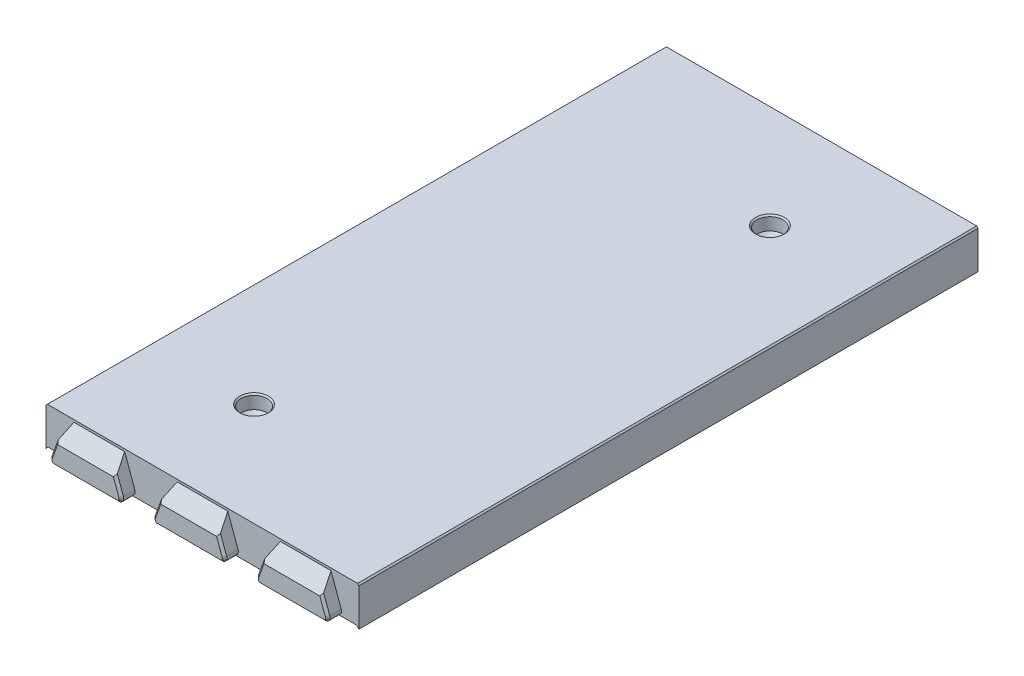
from build123d import *

# Parameters (mm, degrees)
BOSS_EXTRUDE1_DEPTH             = 67.5
SKETCH7_W                       = 64.25
SKETCH7_H                       = 6
BOSS_EXTRUDE7_DEPTH             = 1
BOSS_EXTRUDE4_DEPTH             = 3
BOSS_EXTRUDE8_REACH             = 78.058
BOSS_EXTRUDE8_DIRECTION_2_DEPTH = 2
CHAMFER4_SIZE                   = 0.5
FILLET4_R                       = 1
CHAMFER6_SIZE                   = 0.5
FILLET2_R                       = 2
CHAMFER4_OF_MIRROR2_SIZE        = 0.5
FILLET4_OF_MIRROR2_R            = 1
CHAMFER6_OF_MIRROR2_SIZE        = 0.5
FILLET2_OF_MIRROR2_R            = 2
BOSS_EXTRUDE9_REACH             = 144.382
SKETCH9_R                       = 5
FILLET3_R                       = 3
SKETCH10_R                      = 1.85
CUT_EXTRUDE2_DEPTH              = 143.381584571
SKETCH11_R                      = 2.85
CUT_EXTRUDE3_DEPTH              = 3
CHAMFER7_SIZE                   = 1
CUT_EXTRUDE4_DEPTH              = 143.381584571
CUT_EXTRUDE4_DEPTH_BACK         = 143.381584571
BOSS_EXTRUDE10_DEPTH            = 135
CHAMFER8_SIZE                   = 0.3


with BuildPart() as part:
    # Sketch1 → Boss-Extrude1 (new body)
    with BuildSketch(Plane.XY):
        Polygon((-34.125, 0), (-34.125, 8), (34.125, 8), (34.125, 0), (32.125, 0), (32.125, 6), (-32.125, 6), (-32.125, 0), align=None)
    boss_extrude1 = extrude(amount=-BOSS_EXTRUDE1_DEPTH)

    # Sketch7 → Boss-Extrude7 (add)
    with BuildSketch(Plane.XY):
        with Locations((0, 3)):
            Rectangle(SKETCH7_W, SKETCH7_H)
    boss_extrude7 = extrude(amount=-BOSS_EXTRUDE7_DEPTH)

    # Sketch2 → Boss-Extrude4 (add)
    with BuildSketch(Plane.XY):
        Polygon((17.161761874, 8), (14.25, 0), (30.75, 0), (27.838238126, 8), align=None)
        Polygon((-5.338238126, 8), (-8.25, 0), (8.25, 0), (5.338238126, 8), align=None)
        Polygon((-27.838238126, 8), (-30.75, 0), (-14.25, 0), (-17.161761874, 8), align=None)
    boss_extrude4 = extrude(amount=BOSS_EXTRUDE4_DEPTH)

    # Sketch8 → Boss-Extrude8 (add, up to next)
    with BuildSketch(Plane.XZ, mode=Mode.PRIVATE) as boss_extrude8_sk1:
        Polygon((-32.75, -24.955880937), (-32.75, -20.044119063), (-28.75, -21.5), (-28.75, -23.5), align=None)
    boss_extrude8_tool1 = extrude(boss_extrude8_sk1.sketch, amount=-BOSS_EXTRUDE8_REACH, mode=Mode.PRIVATE) - part.part
    # Sketch8 → Boss-Extrude8 (add, up to next)
    with BuildSketch(Plane.XZ, mode=Mode.PRIVATE) as boss_extrude8_sk2:
        Polygon((-32.75, -67.5), (-32.75, -65.044119063), (-28.75, -66.5), (-28.75, -67.5), align=None)
    boss_extrude8_tool2 = extrude(boss_extrude8_sk2.sketch, amount=-BOSS_EXTRUDE8_REACH, mode=Mode.PRIVATE) - part.part
    # Sketch8 → Boss-Extrude8 (add, up to next)
    with BuildSketch(Plane.XZ, mode=Mode.PRIVATE) as boss_extrude8_sk3:
        Polygon((32.75, -24.955880937), (28.75, -23.5), (28.75, -21.5), (32.75, -20.044119063), align=None)
    boss_extrude8_tool3 = extrude(boss_extrude8_sk3.sketch, amount=-BOSS_EXTRUDE8_REACH, mode=Mode.PRIVATE) - part.part
    # Sketch8 → Boss-Extrude8 (add, up to next)
    with BuildSketch(Plane.XZ, mode=Mode.PRIVATE) as boss_extrude8_sk4:
        Polygon((28.75, -67.5), (32.75, -67.5), (32.75, -65.044119063), (28.75, -66.5), align=None)
    boss_extrude8_tool4 = extrude(boss_extrude8_sk4.sketch, amount=-BOSS_EXTRUDE8_REACH, mode=Mode.PRIVATE) - part.part
    boss_extrude8_1 = boss_extrude8_tool1.solids().sort_by_distance((-31.030851, 0, -22.5))[0]
    add(boss_extrude8_1)
    boss_extrude8_2 = boss_extrude8_tool2.solids().sort_by_distance((-31.030851, 0, -66.584919))[0]
    add(boss_extrude8_2)
    boss_extrude8_3 = boss_extrude8_tool3.solids().sort_by_distance((31.030851, 0, -22.5))[0]
    add(boss_extrude8_3)
    boss_extrude8_4 = boss_extrude8_tool4.solids().sort_by_distance((31.030851, 0, -66.584919))[0]
    add(boss_extrude8_4)
    boss_extrude8 = boss_extrude8_1 + boss_extrude8_2 + boss_extrude8_3 + boss_extrude8_4  # Boss-Extrude8 as one shape, for the pattern or mirror that repeats it

    # Sketch8 → Boss-Extrude8 direction 2 (add)
    with BuildSketch(Plane.XZ):
        Polygon((-32.75, -24.955880937), (-32.75, -20.044119063), (-28.75, -21.5), (-28.75, -23.5), align=None)
        Polygon((-32.75, -67.5), (-32.75, -65.044119063), (-28.75, -66.5), (-28.75, -67.5), align=None)
        Polygon((32.75, -24.955880937), (28.75, -23.5), (28.75, -21.5), (32.75, -20.044119063), align=None)
        Polygon((28.75, -67.5), (32.75, -67.5), (32.75, -65.044119063), (28.75, -66.5), align=None)
    boss_extrude8_direction_2 = extrude(amount=BOSS_EXTRUDE8_DIRECTION_2_DEPTH)

    # Chamfer4
    chamfer4_edges = [part.edges().sort_by_distance(p)[0] for p in [
        (-30.75, -2, -20.772059531),
        (-32.75, -2, -22.5),
        (-30.75, -2, -24.227940469),
        (-28.75, -2, -22.5),
        (32.75, -2, -22.5),
        (30.75, -2, -20.772059531),
        (28.75, -2, -22.5),
        (30.75, -2, -24.227940469),
        (28.75, -2, -67),
        (32.75, -2, -66.272059531),
        (30.75, -2, -65.772059531),
        (-28.75, -2, -67),
        (-30.75, -2, -65.772059531),
        (-32.75, -2, -66.272059531),
    ]]
    chamfer(chamfer4_edges, length=CHAMFER4_SIZE)

    # Fillet4
    fillet4_edges = [part.edges().sort_by_distance(p)[0] for p in [
        (14.25, 0, 1.5),
        (30.75, 0, 1.5),
        (-8.25, 0, 1.5),
        (8.25, 0, 1.5),
        (-30.75, 0, 1.5),
        (-14.25, 0, 1.5),
    ]]
    fillet(fillet4_edges, radius=FILLET4_R)

    # Chamfer6
    chamfer6_edges = [part.edges().sort_by_distance(p)[0] for p in [
        (22.5, 0, 3),
        (0, 0, 3),
        (-22.5, 0, 3),
        (-15.95010863, 4.671010072, 3),
        (-14.858995962, 0.426423564, 3),
        (-30.141004038, 0.426423564, 3),
        (6.54989137, 4.671010072, 3),
        (7.641004038, 0.426423564, 3),
        (-7.641004038, 0.426423564, 3),
        (29.04989137, 4.671010072, 3),
        (30.141004038, 0.426423564, 3),
        (14.858995962, 0.426423564, 3),
        (15.95010863, 4.671010072, 3),
        (-6.54989137, 4.671010072, 3),
        (-29.04989137, 4.671010072, 3),
    ]]
    chamfer(chamfer6_edges, length=CHAMFER6_SIZE)

    # Fillet2
    fillet2_edges = [part.edges().sort_by_distance(p)[0] for p in [
        (-32.125, 6, -10.63580023),
        (-32.125, 3, -20.271600459),
        (-32.125, 3, -24.728399541),
        (-30.4375, 6, -20.88580023),
        (-28.75, 6, -22.5),
        (-30.4375, 6, -24.11419977),
        (32.125, 6, -10.63580023),
        (32.125, 3, -20.271600459),
        (32.125, 3, -24.728399541),
        (30.4375, 6, -20.88580023),
        (30.4375, 6, -24.11419977),
        (28.75, 6, -22.5),
        (32.125, 6, -45),
        (32.125, 3, -65.271600459),
        (28.75, 6, -67),
        (30.4375, 6, -65.88580023),
        (-32.125, 3, -1),
        (0, 6, -1),
        (32.125, 3, -1),
        (-32.125, 6, -45),
        (-32.125, 3, -65.271600459),
        (-28.75, 6, -67),
        (-30.4375, 6, -65.88580023),
    ]]
    fillet(fillet2_edges, radius=FILLET2_R)


with BuildPart() as mirror2_1:
    # Mirror2: Boss-Extrude1, Boss-Extrude7, Boss-Extrude4, Boss-Extrude8, Boss-Extrude8 direction 2 across plane
    add(boss_extrude1.mirror(Plane.XY.offset(-67.5)))
    add(boss_extrude7.mirror(Plane.XY.offset(-67.5)))
    add(boss_extrude4.mirror(Plane.XY.offset(-67.5)))
    add(boss_extrude8.mirror(Plane.XY.offset(-67.5)))
    add(boss_extrude8_direction_2.mirror(Plane.XY.offset(-67.5)))

    # Chamfer4 of Mirror2
    chamfer4_of_mirror2_edges = [mirror2_1.edges().sort_by_distance(p)[0] for p in [
        (-30.75, -2, -114.227940469),
        (-32.75, -2, -112.5),
        (-30.75, -2, -110.772059531),
        (-28.75, -2, -112.5),
        (32.75, -2, -112.5),
        (30.75, -2, -114.227940469),
        (28.75, -2, -112.5),
        (30.75, -2, -110.772059531),
        (28.75, -2, -68),
        (32.75, -2, -68.727940469),
        (30.75, -2, -69.227940469),
        (-28.75, -2, -68),
        (-30.75, -2, -69.227940469),
        (-32.75, -2, -68.727940469),
    ]]
    chamfer(chamfer4_of_mirror2_edges, length=CHAMFER4_OF_MIRROR2_SIZE)

    # Fillet4 of Mirror2
    fillet4_of_mirror2_edges = [mirror2_1.edges().sort_by_distance(p)[0] for p in [
        (14.25, 0, -136.5),
        (30.75, 0, -136.5),
        (-8.25, 0, -136.5),
        (8.25, 0, -136.5),
        (-30.75, 0, -136.5),
        (-14.25, 0, -136.5),
    ]]
    fillet(fillet4_of_mirror2_edges, radius=FILLET4_OF_MIRROR2_R)

    # Chamfer6 of Mirror2
    chamfer6_of_mirror2_edges = [mirror2_1.edges().sort_by_distance(p)[0] for p in [
        (22.5, 0, -138),
        (0, 0, -138),
        (-22.5, 0, -138),
        (-15.95010863, 4.671010072, -138),
        (-14.858995962, 0.426423564, -138),
        (-30.141004038, 0.426423564, -138),
        (6.54989137, 4.671010072, -138),
        (7.641004038, 0.426423564, -138),
        (-7.641004038, 0.426423564, -138),
        (29.04989137, 4.671010072, -138),
        (30.141004038, 0.426423564, -138),
        (14.858995962, 0.426423564, -138),
        (15.95010863, 4.671010072, -138),
        (-6.54989137, 4.671010072, -138),
        (-29.04989137, 4.671010072, -138),
    ]]
    chamfer(chamfer6_of_mirror2_edges, length=CHAMFER6_OF_MIRROR2_SIZE)

    # Fillet2 of Mirror2
    fillet2_of_mirror2_edges = [mirror2_1.edges().sort_by_distance(p)[0] for p in [
        (-32.125, 6, -124.36419977),
        (-32.125, 3, -114.728399541),
        (-32.125, 3, -110.271600459),
        (-30.4375, 6, -114.11419977),
        (-28.75, 6, -112.5),
        (-30.4375, 6, -110.88580023),
        (32.125, 6, -124.36419977),
        (32.125, 3, -114.728399541),
        (32.125, 3, -110.271600459),
        (30.4375, 6, -114.11419977),
        (30.4375, 6, -110.88580023),
        (28.75, 6, -112.5),
        (32.125, 6, -90),
        (32.125, 3, -69.728399541),
        (28.75, 6, -68),
        (30.4375, 6, -69.11419977),
        (-32.125, 3, -134),
        (0, 6, -134),
        (32.125, 3, -134),
        (-32.125, 6, -90),
        (-32.125, 3, -69.728399541),
        (-28.75, 6, -68),
        (-30.4375, 6, -69.11419977),
    ]]
    fillet(fillet2_of_mirror2_edges, radius=FILLET2_OF_MIRROR2_R)


with BuildPart() as part_1:
    add(part.part)

    # Mirror2 united with what the copies touc: union Mirror2_1
    add(mirror2_1.part)

    # Sketch9 → Boss-Extrude9 (add, up to next)
    with BuildSketch(Plane(origin=(0, 0, 0), x_dir=(1, 0, 0), z_dir=(0, 1, 0)), mode=Mode.PRIVATE) as boss_extrude9_sk1:
        with Locations(Location((-11.25, 112.5, 0), (0, 0, 90))):
            Circle(SKETCH9_R)
    boss_extrude9_tool1 = extrude(boss_extrude9_sk1.sketch, amount=BOSS_EXTRUDE9_REACH, mode=Mode.PRIVATE) - part_1.part
    # Sketch9 → Boss-Extrude9 (add, up to next)
    with BuildSketch(Plane(origin=(0, 0, 0), x_dir=(1, 0, 0), z_dir=(0, 1, 0)), mode=Mode.PRIVATE) as boss_extrude9_sk2:
        with Locations(Location((11.25, 112.5, 0), (0, 0, 90))):
            Circle(SKETCH9_R)
    boss_extrude9_tool2 = extrude(boss_extrude9_sk2.sketch, amount=BOSS_EXTRUDE9_REACH, mode=Mode.PRIVATE) - part_1.part
    # Sketch9 → Boss-Extrude9 (add, up to next)
    with BuildSketch(Plane(origin=(0, 0, 0), x_dir=(1, 0, 0), z_dir=(0, 1, 0)), mode=Mode.PRIVATE) as boss_extrude9_sk3:
        with Locations(Location((11.25, 22.5, 0), (0, 0, 90))):
            Circle(SKETCH9_R)
    boss_extrude9_tool3 = extrude(boss_extrude9_sk3.sketch, amount=BOSS_EXTRUDE9_REACH, mode=Mode.PRIVATE) - part_1.part
    # Sketch9 → Boss-Extrude9 (add, up to next)
    with BuildSketch(Plane(origin=(0, 0, 0), x_dir=(1, 0, 0), z_dir=(0, 1, 0)), mode=Mode.PRIVATE) as boss_extrude9_sk4:
        with Locations(Location((-11.25, 22.5, 0), (0, 0, 90))):
            Circle(SKETCH9_R)
    boss_extrude9_tool4 = extrude(boss_extrude9_sk4.sketch, amount=BOSS_EXTRUDE9_REACH, mode=Mode.PRIVATE) - part_1.part
    add(boss_extrude9_tool1.solids().sort_by_distance((-11.25, 0, -112.5))[0])
    add(boss_extrude9_tool2.solids().sort_by_distance((11.25, 0, -112.5))[0])
    add(boss_extrude9_tool3.solids().sort_by_distance((11.25, 0, -22.5))[0])
    add(boss_extrude9_tool4.solids().sort_by_distance((-11.25, 0, -22.5))[0])

    # Fillet3
    fillet3_edges = [part_1.edges().sort_by_distance(p)[0] for p in [
        (-11.25, 6, -107.5),
        (-11.25, 6, -17.5),
        (11.25, 6, -17.5),
        (11.25, 6, -107.5),
    ]]
    fillet(fillet3_edges, radius=FILLET3_R)

    # Sketch10 → Cut-Extrude2 (cut, through all)
    with BuildSketch(Plane(origin=(0, 0, 0), x_dir=(1, 0, 0), z_dir=(0, 1, 0))):
        with Locations(Location((-11.25, 22.5, 0), (0, 0, 270))):
            Circle(SKETCH10_R)
        with Locations(Location((11.25, 112.5, 0), (0, 0, 270))):
            Circle(SKETCH10_R)
    extrude(amount=CUT_EXTRUDE2_DEPTH, mode=Mode.SUBTRACT)

    # Sketch11 → Cut-Extrude3 (cut)
    with BuildSketch(Plane(origin=(0, 8, 0), x_dir=(1, 0, 0), z_dir=(0, 1, 0))):
        with Locations(Location((11.25, 112.5, 0), (0, 0, 270))):
            Circle(SKETCH11_R)
        with Locations(Location((-11.25, 22.5, 0), (0, 0, 270))):
            Circle(SKETCH11_R)
    extrude(amount=-CUT_EXTRUDE3_DEPTH, mode=Mode.SUBTRACT)

    # Chamfer7
    chamfer7_edges = [part_1.edges().sort_by_distance(p)[0] for p in [
        (11.25, 5, -114.35),
        (-11.25, 5, -24.35),
    ]]
    chamfer(chamfer7_edges, length=CHAMFER7_SIZE - 0.0001)  # a hair under: the kernel refuses the full size

    # Sketch12 → Cut-Extrude4 (cut, two sides: drawn at the far end of the back side and taken through both)
    with BuildSketch(Plane(origin=(0, 0, 0), x_dir=(0, 0, -1), z_dir=(1, 0, 0)).offset(-CUT_EXTRUDE4_DEPTH_BACK)):
        Polygon((0, 7.5), (-3, 4.5), (-3, 7.5), (-3, 8), (0, 8), align=None)
        Polygon((138, 4.5), (138, 7.5), (138, 8), (135, 8), (135, 7.5), align=None)
    extrude(amount=CUT_EXTRUDE4_DEPTH + CUT_EXTRUDE4_DEPTH_BACK, mode=Mode.SUBTRACT)

    # Sketch13 → Boss-Extrude10 (add)
    with BuildSketch(Plane(origin=(0, 0, -135), x_dir=(-1, 0, 0), z_dir=(0, 0, -1))):
        Polygon((-33.625, 0), (-34.125, -0.5), (-34.125, 0), align=None)
        Polygon((34.125, 0), (33.625, 0), (34.125, -0.5), align=None)
    extrude(amount=-BOSS_EXTRUDE10_DEPTH)

    # Chamfer8
    chamfer8_edges = [part_1.edges().sort_by_distance(p)[0] for p in [
        (-34.125, 8, -67.5),
        (34.125, 8, -67.5),
        (11.25, 8, -115.35),
        (-11.25, 8, -25.35),
    ]]
    chamfer(chamfer8_edges, length=CHAMFER8_SIZE)


solid = part_1.part
